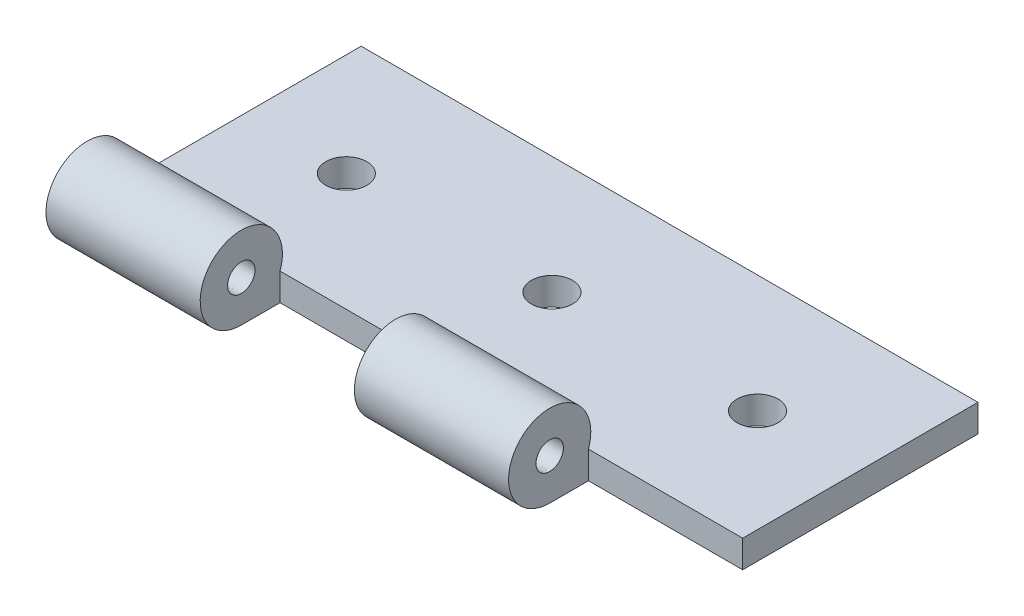
from build123d import *
from OCP.BRepAlgoAPI import BRepAlgoAPI_Cut
from OCP.TopTools import TopTools_ListOfShape

# Parameters (mm, degrees)
IZIM1_W                     = 45
IZIM1_H                     = 20
Y_KSEKLIK_EKSTR_ZYON1_DEPTH = 2
IZIM2_R                     = 3
IZIM2_R_2                   = 1
Y_KSEKLIK_EKSTR_ZYON2_DEPTH = 45
IZIM4_R                     = 1.5
KES_EKSTR_ZYON1_DEPTH       = 45
L_O_ALTMA1_COUNT            = 3
L_O_ALTMA1_PITCH            = 15
KES_EKSTR_ZYON3_START       = -11.25
KES_EKSTR_ZYON3_DEPTH       = 11.25
L_O_ALTMA7_START            = -11.25
L_O_ALTMA7_DEPTH            = 11.25


with BuildPart() as part:
    # Çizim1 → Yükseklik-Ekstrüzyon1 (new body)
    with BuildSketch(Plane(origin=(0, 0, 0), x_dir=(1, 0, 0), z_dir=(0, 1, 0))):
        Rectangle(IZIM1_W, IZIM1_H)
    extrude(amount=Y_KSEKLIK_EKSTR_ZYON1_DEPTH)

    # Çizim2 → Yükseklik-Ekstrüzyon2 (add)
    with BuildSketch(Plane(origin=(22.5, 0, 0), x_dir=(0, 0, -1), z_dir=(1, 0, 0))):
        with Locations((-9.996930096, 2.999998429)):
            Circle(IZIM2_R)
        with Locations((-9.996930096, 2.999998429)):
            Circle(IZIM2_R_2, mode=Mode.SUBTRACT)
    extrude(amount=-Y_KSEKLIK_EKSTR_ZYON2_DEPTH)

    # Çizim4 → Kes-Ekstrüzyon1 (cut)
    with BuildSketch(Plane(origin=(0, 2, 0), x_dir=(1, 0, 0), z_dir=(0, 1, 0))):
        with Locations(Location((-15, 1.415748792, 0), (0, 0, 270))):
            Circle(IZIM4_R)
    kes_ekstr_zyon1 = extrude(amount=-KES_EKSTR_ZYON1_DEPTH, mode=Mode.SUBTRACT)

    # LÇoğaltma1: Kes-Ekstrüzyon1 ×3
    with Locations(*[(i * L_O_ALTMA1_PITCH, 0, 0) for i in range(1, L_O_ALTMA1_COUNT)]):
        add(kes_ekstr_zyon1, mode=Mode.SUBTRACT)


with BuildPart() as kes_ekstr_zyon3_tool:
    # Kes-Ekstrüzyon3: read off the stored shape, not the designer's step
    # Kes-Ekstrüzyon3 outline → Kes-Ekstrüzyon3 (new body)
    with BuildSketch(Plane(origin=(22.5, 0, 0), x_dir=(0, 0, -1), z_dir=(1, 0, 0)).offset(KES_EKSTR_ZYON3_START)):
        with BuildLine():
            Line((-7.168502416, 0), (-7.168502416, 2))
            ThreePointArc((-7.168502416, 2), (-11.727728074, 5.450373576), (-10, 0))
            Line((-10, 0), (-7.168502416, 0))
        make_face()
        with BuildLine():
            Line((-9.996930096, 1.999998429), (-9.99999999, 2.000003141))
            ThreePointArc((-9.99999999, 2.000003141), (-9.995395236, 3.999997251), (-9.996930096, 1.999998429))
        make_face(mode=Mode.SUBTRACT)
    extrude(amount=KES_EKSTR_ZYON3_DEPTH)


with BuildPart() as part_1:
    add(part.part)

    # Kes-Ekstrüzyon3: cut by kes_ekstr_zyon3_tool, with a tolerance
    kes_ekstr_zyon3_stock = TopTools_ListOfShape()
    kes_ekstr_zyon3_stock.Append(part_1.part.wrapped)
    kes_ekstr_zyon3_tools = TopTools_ListOfShape()
    kes_ekstr_zyon3_tools.Append(kes_ekstr_zyon3_tool.part.wrapped)
    kes_ekstr_zyon3_cut = BRepAlgoAPI_Cut()
    kes_ekstr_zyon3_cut.SetArguments(kes_ekstr_zyon3_stock)
    kes_ekstr_zyon3_cut.SetTools(kes_ekstr_zyon3_tools)
    kes_ekstr_zyon3_cut.SetFuzzyValue(0.00001)
    kes_ekstr_zyon3_cut.Build()
    add(Compound.cast(kes_ekstr_zyon3_cut.Shape()).solids(), mode=Mode.REPLACE)


with BuildPart() as l_o_altma7_tool:
    # LÇoğaltma7: read off the stored shape, not the designer's step
    # LÇoğaltma7 outline → LÇoğaltma7 (new body)
    with BuildSketch(Plane.YZ.offset(L_O_ALTMA7_START)):
        with BuildLine():
            Line((0, 7.168502416), (2, 7.168502416))
            ThreePointArc((2, 7.168502416), (5.450373576, 11.727728074), (0, 10))
            Line((0, 10), (0, 7.168502416))
        make_face()
        with BuildLine():
            Line((1.999998429, 9.996930096), (2.000003141, 9.99999999))
            ThreePointArc((2.000003141, 9.99999999), (3.999997251, 9.995395236), (1.999998429, 9.996930096))
        make_face(mode=Mode.SUBTRACT)
    extrude(amount=L_O_ALTMA7_DEPTH)


with BuildPart() as part_2:
    add(part_1.part)

    # LÇoğaltma7: cut by l_o_altma7_tool, with a tolerance
    l_o_altma7_stock = TopTools_ListOfShape()
    l_o_altma7_stock.Append(part_2.part.wrapped)
    l_o_altma7_tools = TopTools_ListOfShape()
    l_o_altma7_tools.Append(l_o_altma7_tool.part.wrapped)
    l_o_altma7_cut = BRepAlgoAPI_Cut()
    l_o_altma7_cut.SetArguments(l_o_altma7_stock)
    l_o_altma7_cut.SetTools(l_o_altma7_tools)
    l_o_altma7_cut.SetFuzzyValue(0.00001)
    l_o_altma7_cut.Build()
    add(Compound.cast(l_o_altma7_cut.Shape()).solids(), mode=Mode.REPLACE)


solid = part_2.part
